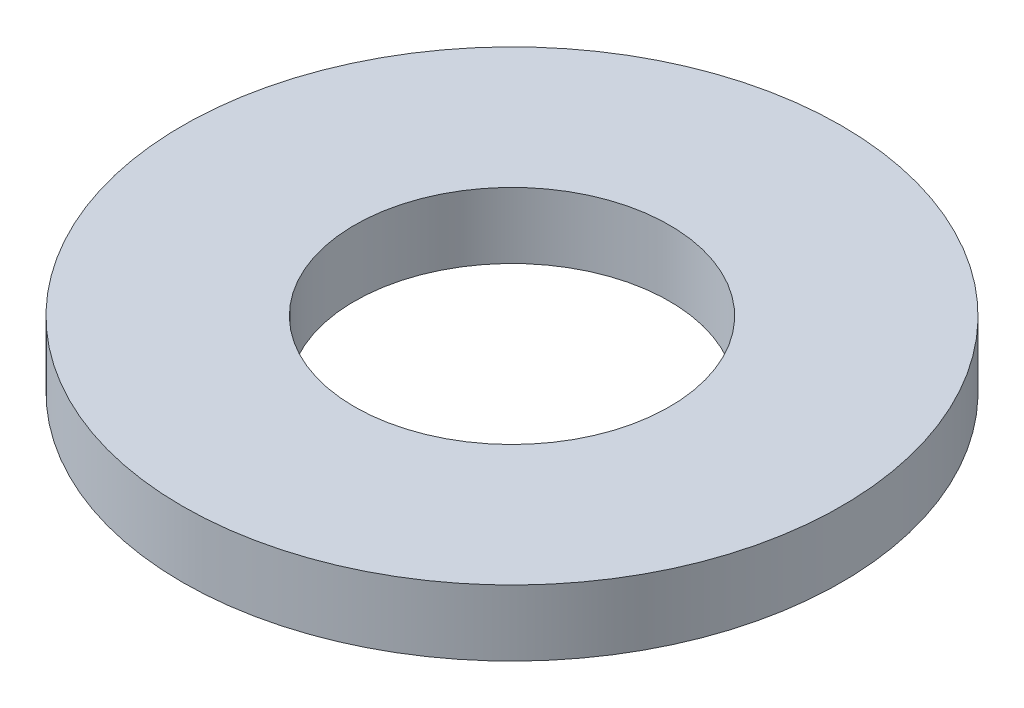
from build123d import *

# Parameters (mm, degrees)
IZIM2_R          = 4.5
IZIM2_R_2        = 2.15
EXTRUDE_M4_DEPTH = 0.9


with BuildPart() as part:
    # Çizim2 → M4 (new body)
    with BuildSketch(Plane(origin=(0, 0, 0), x_dir=(1, 0, 0), z_dir=(0, 1, 0))):
        Circle(IZIM2_R)
        Circle(IZIM2_R_2, mode=Mode.SUBTRACT)
    extrude(amount=EXTRUDE_M4_DEPTH)


solid = part.part
